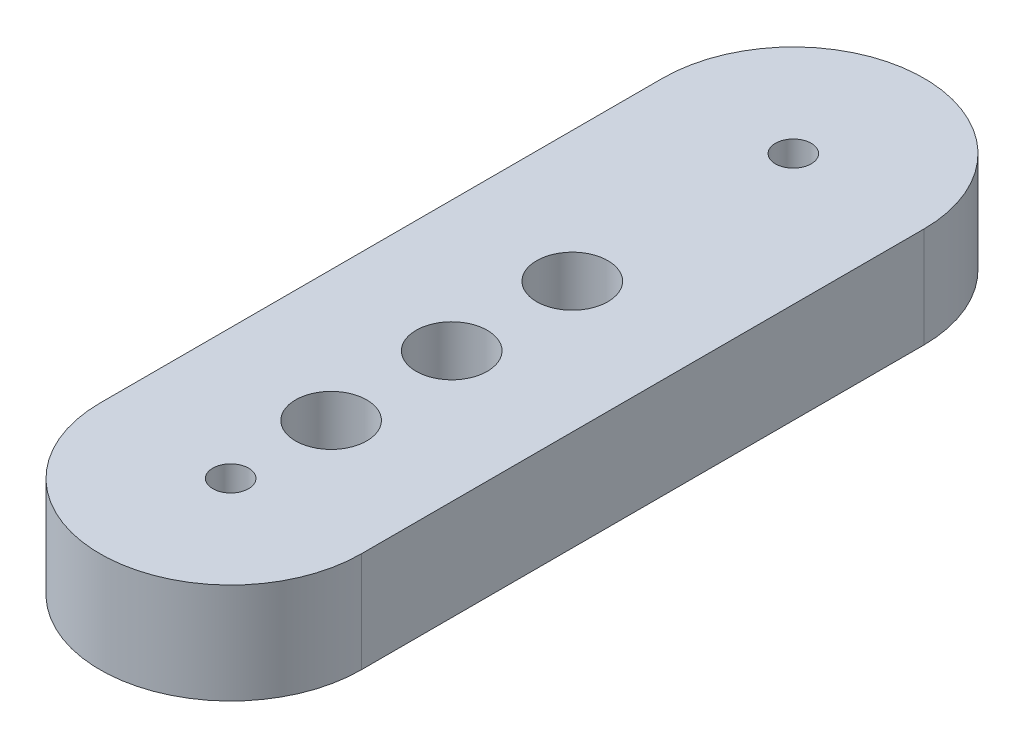
from build123d import *

# Parameters (mm, degrees)
SKETCH1_R           = 1.1303
SKETCH1_R_2         = 2.25
BOSS_EXTRUDE1_DEPTH = 6.35


with BuildPart() as part:
    # Sketch1 → Boss-Extrude1 (new body)
    with BuildSketch(Plane(origin=(0, 0, 0), x_dir=(1, 0, 0), z_dir=(0, 1, 0))):
        with BuildLine():
            Line((-8.255, -17.78), (-8.255, 17.78))
            ThreePointArc((-8.255, 17.78), (0, 26.035), (8.255, 17.78))
            Line((8.255, 17.78), (8.255, -17.78))
            ThreePointArc((8.255, -17.78), (0, -26.035), (-8.255, -17.78))
        make_face()
        with Locations((0, 17.78)):
            Circle(SKETCH1_R, mode=Mode.SUBTRACT)
        with Locations((0, -17.78)):
            Circle(SKETCH1_R, mode=Mode.SUBTRACT)
        with Locations((0, -11.43)):
            Circle(SKETCH1_R_2, mode=Mode.SUBTRACT)
        with Locations((0, -3.81)):
            Circle(SKETCH1_R_2, mode=Mode.SUBTRACT)
        with Locations((0, 3.81)):
            Circle(SKETCH1_R_2, mode=Mode.SUBTRACT)
    extrude(amount=BOSS_EXTRUDE1_DEPTH)


solid = part.part
